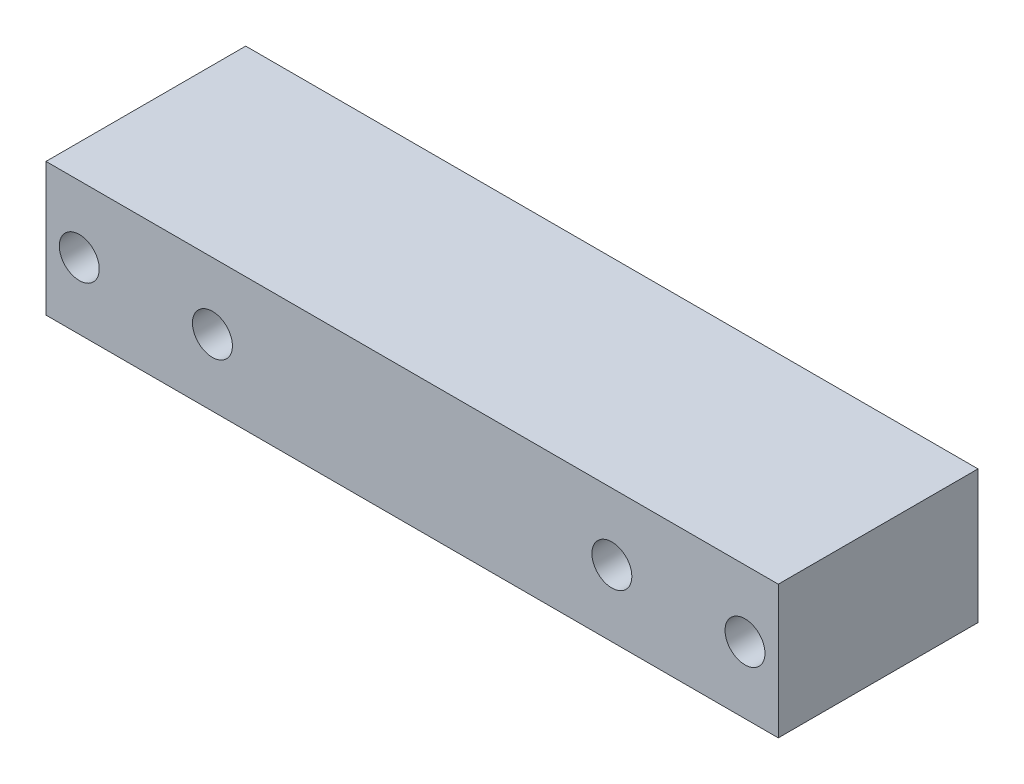
from build123d import *

# Parameters (mm, degrees)
SKETCH1_W           = 55
SKETCH1_H           = 10
SKETCH1_R           = 1.5
BOSS_EXTRUDE1_DEPTH = 15


with BuildPart() as part:
    # Sketch1 → Boss-Extrude1 (new body)
    with BuildSketch(Plane.XY):
        with Locations((-27.5, 5)):
            Rectangle(SKETCH1_W, SKETCH1_H)
        with Locations((-2.5, 5)):
            Circle(SKETCH1_R, mode=Mode.SUBTRACT)
        with Locations((-12.5, 5)):
            Circle(SKETCH1_R, mode=Mode.SUBTRACT)
        with Locations((-42.5, 5)):
            Circle(SKETCH1_R, mode=Mode.SUBTRACT)
        with Locations((-52.5, 5)):
            Circle(SKETCH1_R, mode=Mode.SUBTRACT)
    extrude(amount=BOSS_EXTRUDE1_DEPTH)


solid = part.part
